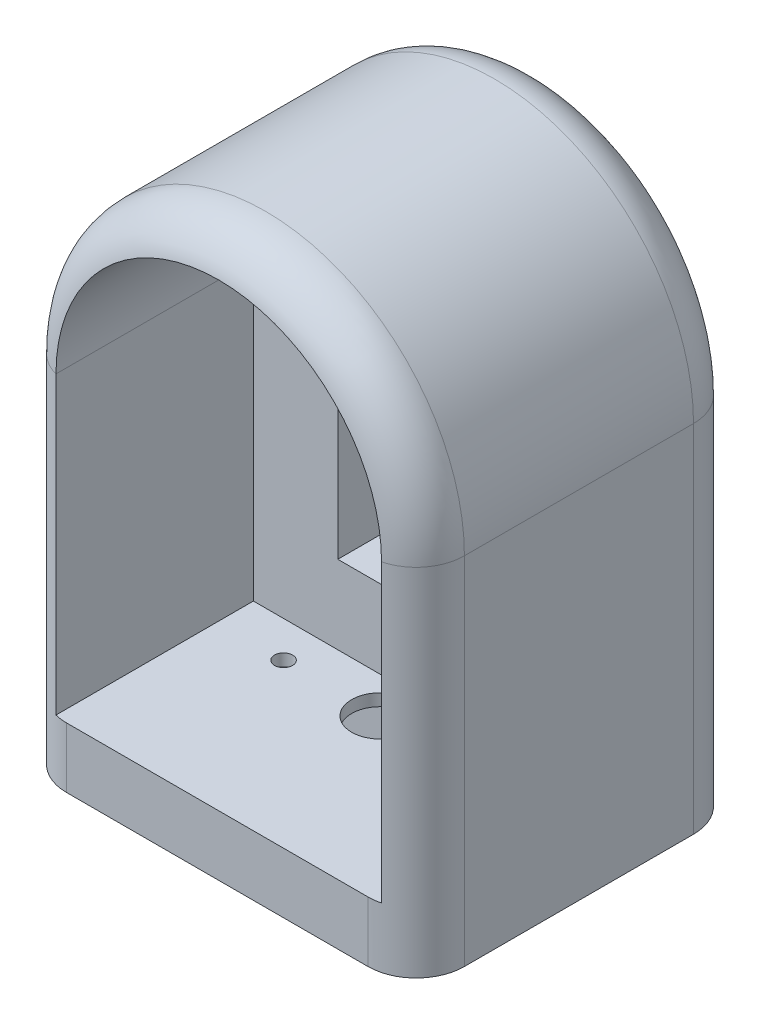
from build123d import *

# Parameters (mm, degrees)
SKETCH1_W               = 33
SKETCH1_H               = 27
BOSS_EXTRUDE1_DEPTH     = 46
SKETCH2_W               = 16.5
SKETCH2_H               = 41
CUT_EXTRUDE1_DEPTH      = 59.200085911
FILLET1_RADIUS          = 16.5
FILLET1_LENGTH          = 10.5
SKETCH3_W               = 13
SKETCH3_H               = 23
CUT_EXTRUDE2_DEPTH      = 9
CUT_EXTRUDE3_DEPTH      = 56.12259065
CUT_EXTRUDE3_DEPTH_BACK = 56.12259065
SKETCH4_R               = 6.5
SKETCH5_R               = 1
CUT_EXTRUDE4_DEPTH      = 8
BOSS_EXTRUDE2_START     = 16.5
BOSS_EXTRUDE2_DEPTH     = 16.5
FILLET2_R               = 4
CUT_EXTRUDE5_DEPTH      = 4
SKETCH8_R               = 1.3
CUT_EXTRUDE6_DEPTH      = 1.75
SKETCH9_R               = 2.35
CUT_EXTRUDE7_DEPTH      = 1
SKETCH10_R              = 0.75
CUT_EXTRUDE8_DEPTH      = 1.75


with BuildPart() as part:
    # Sketch1 → Boss-Extrude1 (new body)
    with BuildSketch(Plane(origin=(0, 0, 0), x_dir=(1, 0, 0), z_dir=(0, 1, 0))):
        Rectangle(SKETCH1_W, SKETCH1_H)
    extrude(amount=BOSS_EXTRUDE1_DEPTH)

    # Sketch2 → Cut-Extrude1 (cut, through all)
    with BuildSketch(Plane(origin=(16.5, 0, 0), x_dir=(0, 0, -1), z_dir=(1, 0, 0))):
        with Locations((-5.25, 25.5)):
            Rectangle(SKETCH2_W, SKETCH2_H)
    extrude(amount=-CUT_EXTRUDE1_DEPTH, mode=Mode.SUBTRACT)

    # Fillet1: full round fillet: the end face becomes a half cylinder, R = half its width
    fillet1_face = Plane((0, 46, -8.25), x_dir=(0, 0, 1), z_dir=(0, 1, 0))  # on the end face: x along it, z out of the body
    fillet1_slab = fillet1_face.offset(-FILLET1_RADIUS / 2) * Box(FILLET1_LENGTH, 2 * FILLET1_RADIUS, FILLET1_RADIUS, mode=Mode.PRIVATE)  # the body's end, R deep
    fillet1_round = Plane((0, 29.5, -8.25), x_dir=(0, 1, 0), z_dir=(0, 0, 1)) * Cylinder(FILLET1_RADIUS, FILLET1_LENGTH, mode=Mode.PRIVATE)  # its axis R under the face
    add(fillet1_slab - fillet1_round, mode=Mode.SUBTRACT)

    # Sketch3 → Cut-Extrude2 (cut)
    with BuildSketch(Plane.XY.offset(-3)):
        with Locations((0, 23)):
            Rectangle(SKETCH3_W, SKETCH3_H)
    extrude(amount=-CUT_EXTRUDE2_DEPTH, mode=Mode.SUBTRACT)

    # Sketch4 → Cut-Extrude3 (cut, two sides: drawn at the far end of the back side and taken through both)
    with BuildSketch(Plane.XY.offset(-12).offset(-CUT_EXTRUDE3_DEPTH_BACK)):
        with Locations((0, 28)):
            Circle(SKETCH4_R)
    extrude(amount=CUT_EXTRUDE3_DEPTH + CUT_EXTRUDE3_DEPTH_BACK, mode=Mode.SUBTRACT)

    # Sketch5 → Cut-Extrude4 (cut)
    with BuildSketch(Plane.XY.offset(-3)):
        with Locations((0, 36.8)):
            Circle(SKETCH5_R)
        with Locations((0, 9.2)):
            Circle(SKETCH5_R)
    extrude(amount=-CUT_EXTRUDE4_DEPTH, mode=Mode.SUBTRACT)

    # Sketch6 → Boss-Extrude2 (add)
    with BuildSketch(Plane.XY.offset(-3).offset(BOSS_EXTRUDE2_START)):
        with BuildLine():
            Line((13.5, 5), (16.5, 5))
            Line((16.5, 5), (16.5, 29.5))
            ThreePointArc((16.5, 29.5), (0, 46), (-16.5, 29.5))
            Line((-16.5, 29.5), (-16.5, 5))
            Line((-16.5, 5), (-13.5, 5))
            Line((-13.5, 5), (-13.5, 8))
            Line((-13.5, 8), (-13.5, 29.5))
            ThreePointArc((-13.5, 29.5), (0, 43), (13.5, 29.5))
            Line((13.5, 29.5), (13.5, 8))
            Line((13.5, 8), (13.5, 5))
        make_face()
    extrude(amount=-BOSS_EXTRUDE2_DEPTH)

    # Fillet2
    # the kernel refuses this fillet: 4 mm, written as the material it takes off along each edge
    with BuildSketch(Plane(origin=(16.5, -10, 13.5), x_dir=(-1, 0, 0), z_dir=(0, 1, 0)), Plane(origin=(-16.5, 29.5, 13.5), x_dir=(1, 0, 0), z_dir=(0, -1, 0)), Plane(origin=(-16.5, -10, -13.5), x_dir=(1, 0, 0), z_dir=(0, 1, 0))) as fillet2_piece_1:
        with BuildLine():
            CenterArc((FILLET2_R, -FILLET2_R), FILLET2_R, 90, 90)
            Line((0, -FILLET2_R), (0, 0))
            Line((0, 0), (FILLET2_R, 0))
        make_face()
    extrude(amount=39.5, mode=Mode.SUBTRACT)
    with BuildSketch(Plane(origin=(16.5, -10, -13.5), x_dir=(-1, 0, 0), z_dir=(0, 1, 0))) as fillet2_piece_2:
        with BuildLine():
            CenterArc((FILLET2_R, FILLET2_R), FILLET2_R, 180, 90)
            Line((0, FILLET2_R), (0, 0))
            Line((0, 0), (FILLET2_R, 0))
        make_face()
    extrude(amount=39.5, mode=Mode.SUBTRACT)
    with BuildSketch(Plane(origin=(0, 29.5, -13.5), x_dir=(-1, 0, 0), z_dir=(0, -1, 0))) as fillet2_piece_3:
        with BuildLine():
            CenterArc((16.5 - FILLET2_R, -FILLET2_R), FILLET2_R, 0, 90)
            Line((16.5, -FILLET2_R), (16.5, 0))
            Line((16.5, 0), (16.5 - FILLET2_R, 0))
        make_face()
    revolve(axis=Axis((0, 29.5, -13.5), (0, 0, -1)), revolution_arc=180, mode=Mode.SUBTRACT)
    with BuildSketch(Plane(origin=(0, 29.5, 13.5), x_dir=(1, 0, 0), z_dir=(0, -1, 0))) as fillet2_piece_4:
        with BuildLine():
            CenterArc((16.5 - FILLET2_R, -FILLET2_R), FILLET2_R, 360, 90)
            Line((16.5, -FILLET2_R), (16.5, 0))
            Line((16.5, 0), (16.5 - FILLET2_R, 0))
        make_face()
    revolve(axis=Axis((0, 29.5, 13.5), (0, 0, 1)), revolution_arc=180, mode=Mode.SUBTRACT)

    # Sketch7 → Cut-Extrude5 (cut)
    with BuildSketch(Plane.XZ):
        with BuildLine():
            Line((-14.09375, 1.747487035), (-0.133928571, 2.49641005))
            ThreePointArc((-0.133928571, 2.49641005), (0, 2.5), (0.133928571, 2.49641005))
            Line((0.133928571, 2.49641005), (14.09375, 1.747487035))
            ThreePointArc((14.09375, 1.747487035), (15.75, 0), (14.09375, -1.747487035))
            Line((14.09375, -1.747487035), (0.133928571, -2.49641005))
            ThreePointArc((0.133928571, -2.49641005), (0, -2.5), (-0.133928571, -2.49641005))
            Line((-0.133928571, -2.49641005), (-14.09375, -1.747487035))
            ThreePointArc((-14.09375, -1.747487035), (-15.75, 0), (-14.09375, 1.747487035))
        make_face()
    extrude(amount=-CUT_EXTRUDE5_DEPTH, mode=Mode.SUBTRACT)

    # Sketch8 → Cut-Extrude6 (cut)
    with BuildSketch(Plane.XZ.offset(-4)):
        with Locations(Location((0, 0, 0), (0, 0, 270))):
            Circle(SKETCH8_R)
    extrude(amount=-CUT_EXTRUDE6_DEPTH, mode=Mode.SUBTRACT)

    # Sketch9 → Cut-Extrude7 (cut)
    with BuildSketch(Plane(origin=(0, 5, 0), x_dir=(1, 0, 0), z_dir=(0, 1, 0))):
        with Locations(Location((0, 0, 0), (0, 0, 270))):
            Circle(SKETCH9_R)
    extrude(amount=-CUT_EXTRUDE7_DEPTH, mode=Mode.SUBTRACT)

    # Sketch10 → Cut-Extrude8 (cut)
    with BuildSketch(Plane.XZ.offset(-4)):
        with Locations(Location((8, 0, 0), (0, 0, 270))):
            Circle(SKETCH10_R)
        with Locations(Location((-8, 0, 0), (0, 0, 270))):
            Circle(SKETCH10_R)
    extrude(amount=-CUT_EXTRUDE8_DEPTH, mode=Mode.SUBTRACT)


solid = part.part
